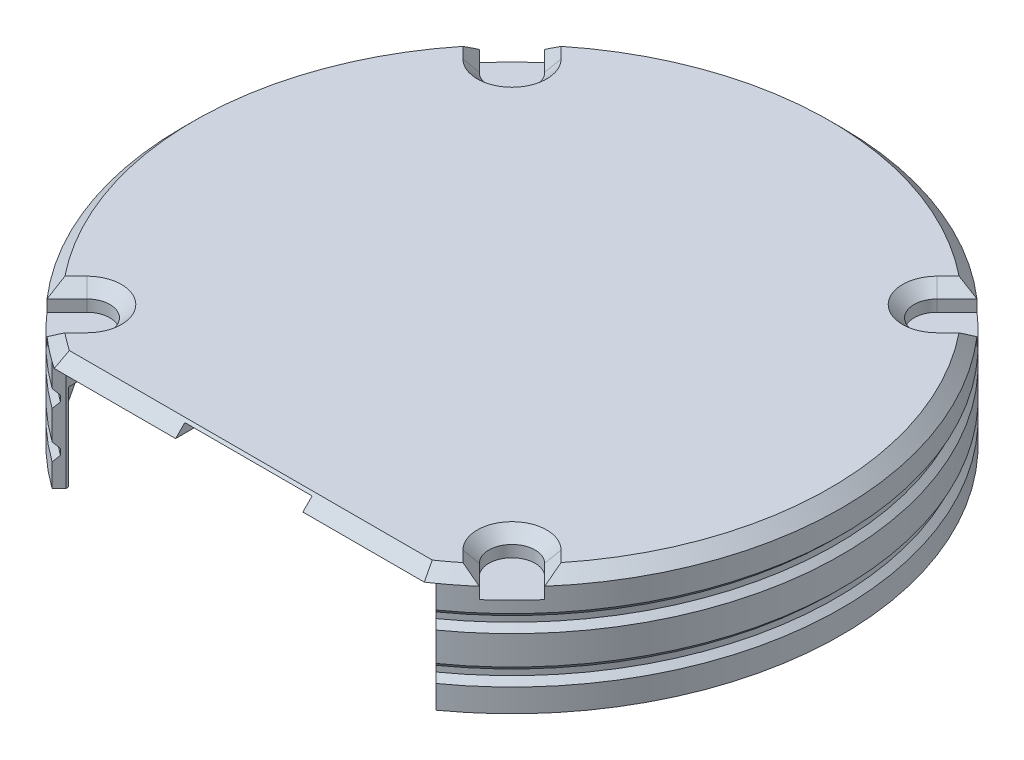
from build123d import *

# Parameters (mm, degrees)
SKETCH1_R           = 28.5
BOSS_EXTRUDE1_DEPTH = 10.5
SHELL1_OUTLINE_R    = 27.5
SHELL1_DEPTH        = 7.5
CUT_EXTRUDE3_DEPTH  = 9.5
CUT_EXTRUDE4_DEPTH  = 42.409539964
CUT_EXTRUDE2_START  = -2
CUT_EXTRUDE2_DEPTH  = 2
CIRPATTERN1_COUNT   = 4
CHAMFER2_SIZE       = 1
CUT_EXTRUDE5_DEPTH  = 0.8
CHAMFER3_SIZE       = 1


with BuildPart() as part:
    # Sketch1 → Boss-Extrude1 (new body)
    with BuildSketch(Plane(origin=(0, 0, 0), x_dir=(1, 0, 0), z_dir=(0, 1, 0))):
        with Locations(Location((0, 0, 0), (0, 0, 90))):
            Circle(SKETCH1_R)
    extrude(amount=BOSS_EXTRUDE1_DEPTH)

    # Shell1: read off the stored shape, not the designer's step
    # Shell1 outline → Shell1 (cut)
    with BuildSketch(Plane(origin=(0, 0, 0), x_dir=(1, 0, 0), z_dir=(0, 1, 0))):
        Circle(SHELL1_OUTLINE_R)
    extrude(amount=SHELL1_DEPTH, mode=Mode.SUBTRACT)

    # Sketch6 → Cut-Extrude3 (cut)
    with BuildSketch(Plane.XZ):
        with BuildLine():
            Line((16, 28.5), (16, 15.81929202))
            ThreePointArc((16, 15.81929202), (0, -22.5), (-16, 15.81929202))
            Line((-16, 15.81929202), (-16, 28.5))
            Line((-16, 28.5), (16, 28.5))
        make_face()
    extrude(amount=-CUT_EXTRUDE3_DEPTH, mode=Mode.SUBTRACT)

    # Sketch7 → Cut-Extrude4 (cut, through all)
    with BuildSketch(Plane.XZ.offset(-9.5)):
        with BuildLine():
            Line((-16, 23.58495283), (16, 23.58495283))
            ThreePointArc((16, 23.58495283), (0, 28.5), (-16, 23.58495283))
        make_face()
    extrude(amount=-CUT_EXTRUDE4_DEPTH, mode=Mode.SUBTRACT)

    # Sketch3 → Cut-Extrude2 (cut)
    with BuildSketch(Plane(origin=(0, 10.5, 0), x_dir=(1, 0, 0), z_dir=(0, 1, 0)).offset(CUT_EXTRUDE2_START)):
        with BuildLine():
            Line((16.970562748, -19.798989873), (18.688646931, -21.517074055))
            ThreePointArc((18.688646931, -21.517074055), (20.152543264, -20.152543264), (21.517074055, -18.688646931))
            Line((21.517074055, -18.688646931), (19.798989873, -16.970562748))
            ThreePointArc((19.798989873, -16.970562748), (16.970562748, -16.970562748), (16.970562748, -19.798989873))
        make_face()
    cut_extrude2 = extrude(amount=CUT_EXTRUDE2_DEPTH, mode=Mode.SUBTRACT)

    # CirPattern1: Cut-Extrude2 ×4 about axis
    cirpattern1_axis = Axis((0, 0, 0), (0, 1, 0))
    for i in range(1, CIRPATTERN1_COUNT):
        add(cut_extrude2.rotate(cirpattern1_axis, i * 360 / CIRPATTERN1_COUNT), mode=Mode.SUBTRACT)

    # Chamfer2
    chamfer2_edges = [part.edges().sort_by_distance(p)[0] for p in [
        (-20.658031964, 10.5, 17.82960484),
        (-16.970562748, 10.5, 16.970562748),
        (-17.82960484, 10.5, 20.658031964),
        (-17.375114018, 10.5, 22.591047184),
        (0, 10.5, 23.58495283),
        (17.375114018, 10.5, 22.591047184),
        (17.82960484, 10.5, 20.658031964),
        (16.970562748, 10.5, 16.970562748),
        (20.658031964, 10.5, 17.82960484),
        (28.5, 10.5, 0),
        (20.658031964, 10.5, -17.82960484),
        (16.970562748, 10.5, -16.970562748),
        (17.82960484, 10.5, -20.658031964),
        (0, 10.5, -28.5),
        (-17.82960484, 10.5, -20.658031964),
        (-16.970562748, 10.5, -16.970562748),
        (-20.658031964, 10.5, -17.82960484),
        (-28.5, 10.5, 0),
    ]]
    chamfer(chamfer2_edges, length=CHAMFER2_SIZE - 0.0001)  # a hair under: the kernel refuses the full size

    # Sketch9 → Cut-Extrude5 (cut)
    with BuildSketch(Plane.XZ.offset(-9.5)):
        with BuildLine():
            Line((-5.5, 23.58495283), (5.5, 23.58495283))
            Line((5.5, 23.58495283), (5.5, 15.58495283))
            ThreePointArc((5.5, 15.58495283), (4.914213562, 14.170739268), (3.5, 13.58495283))
            Line((3.5, 13.58495283), (-3.5, 13.58495283))
            ThreePointArc((-3.5, 13.58495283), (-4.914213562, 14.170739268), (-5.5, 15.58495283))
            Line((-5.5, 15.58495283), (-5.5, 23.58495283))
        make_face()
    extrude(amount=-CUT_EXTRUDE5_DEPTH, mode=Mode.SUBTRACT)

    # Chamfer3
    # the kernel refuses this chamfer: 1, 0.719970543 mm, written as the material it takes off along each edge
    with BuildSketch(Plane(origin=(-16, 9.5, 23.58495283), x_dir=(-0.8204018927518858, 0, -0.5717873156770121), z_dir=(0, -1, 0))) as chamfer3_piece_1:
        with BuildLine():
            Line((0.71829317, 0), (CHAMFER3_SIZE * 0.571787315677, CHAMFER3_SIZE * 0.820401892752))
            Line((CHAMFER3_SIZE * 0.571787315677, CHAMFER3_SIZE * 0.820401892752), (0, 0))
            ThreePointArc((0, 0), (0.362660378, -0.00226279), (0.71829317, 0))
        make_face()
    extrude(amount=12.071682988, mode=Mode.SUBTRACT)
    with BuildSketch(Plane(origin=(16, 9.5, 23.58495283), x_dir=(0.8204018927518871, 0, -0.5717873156770101), z_dir=(0, -1, 0))) as chamfer3_piece_2:
        with BuildLine():
            Line((0.71829317, 0), (CHAMFER3_SIZE * 0.571787315677, -CHAMFER3_SIZE * 0.820401892752))
            Line((CHAMFER3_SIZE * 0.571787315677, -CHAMFER3_SIZE * 0.820401892752), (0, 0))
            ThreePointArc((0, 0), (0.362660378, 0.00226279), (0.71829317, 0))
        make_face()
    extrude(amount=12.071682988, mode=Mode.SUBTRACT)

    # Sketch11 → Cut-Revolve2 (revolve, cut)
    with BuildSketch(Plane.XY):
        Polygon((28, 7), (28, 6.5), (28.5, 6), (28.5, 3.5), (28, 3), (28, 2.5), (28.5, 2), (29.5, 2), (29.5, 7.5), (28.5, 7.5), align=None)
    revolve(axis=Axis((0, 43.121181377, 0), (0, -1, 0)), mode=Mode.SUBTRACT)


solid = part.part
